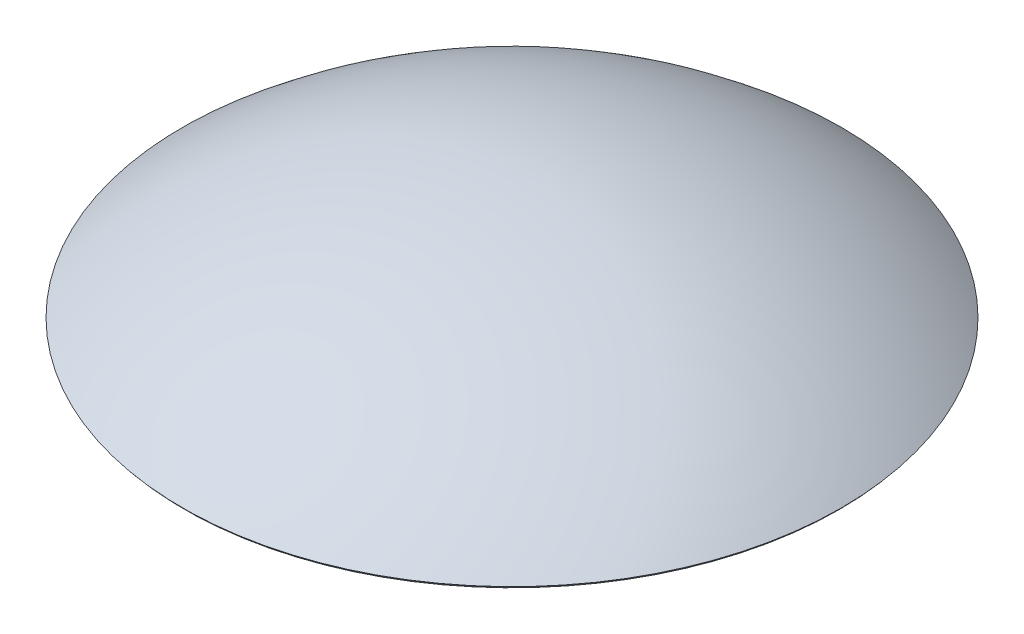
from build123d import *


with BuildPart() as part:
    # Sketch1 → Revolve1 (revolve)
    with BuildSketch(Plane.XY):
        with BuildLine():
            Line((0, 246.825), (0, 250))
            ThreePointArc((0, 250), (-85.505035831, 234.923155196), (-160.696902422, 191.51111078))
            Line((-160.696902422, 191.51111078), (-159.676477091, 190.295015226))
            ThreePointArc((-159.676477091, 190.295015226), (-151.223948484, 197.078886645), (-142.483556495, 203.487607202))
            Line((-142.483556495, 203.487607202), (-141.573003902, 202.187203332))
            ThreePointArc((-141.573003902, 202.187203332), (-74.221708963, 235.401186368), (0, 246.825))
        make_face()
    revolve(axis=Axis((0, 246.825, 0), (0, 1, 0)))


solid = part.part
